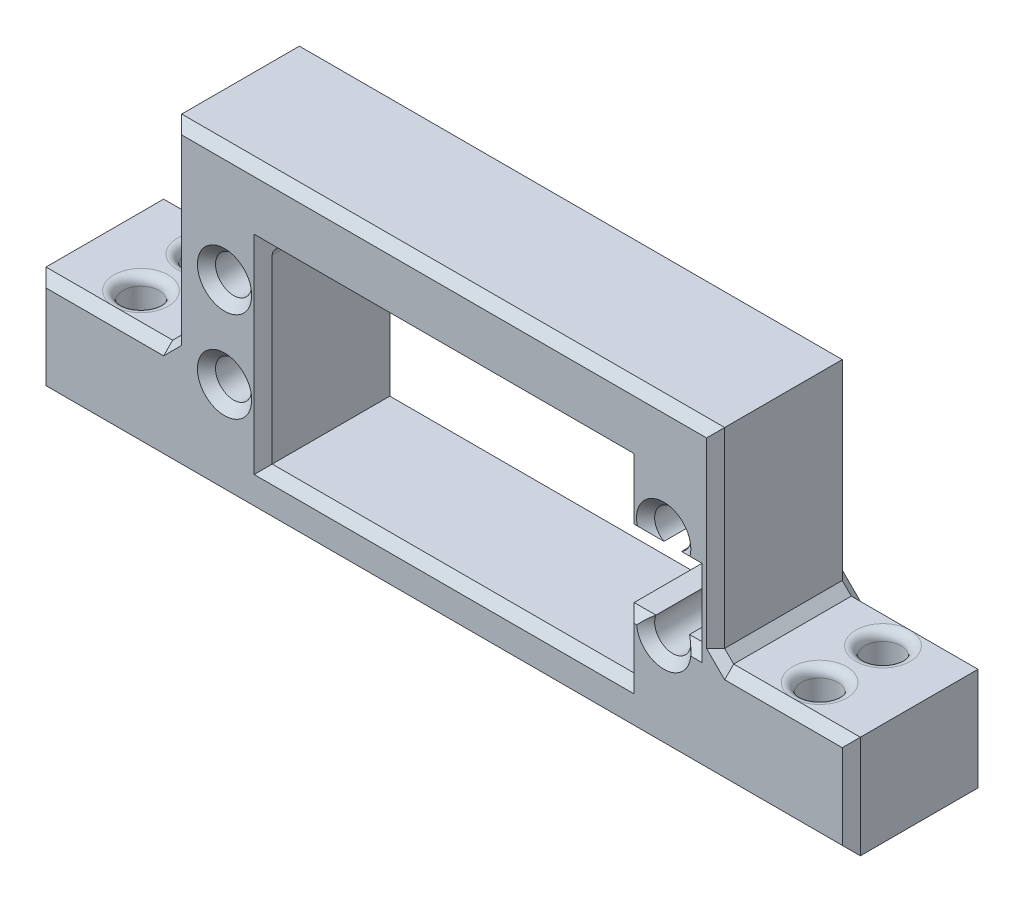
from build123d import *

# Parameters (mm, degrees)
SKETCH1_R               = 2
BOSS_EXTRUDE1_DEPTH     = 15
CUT_EXTRUDE1_DEPTH      = 53.347854185
CUT_EXTRUDE1_DEPTH_BACK = 53.347854185
SKETCH2_R               = 2
CHAMFER1_SIZE           = 1
FILLET1_R               = 1


with BuildPart() as part:
    # Sketch1 → Boss-Extrude1 (new body)
    with BuildSketch(Plane.XY):
        Polygon((30, 6.357329932), (30, 28.5), (-30, 28.5), (-30, 6.357329932), (-45, 6.357329932), (-45, -5), (45, -5), (45, 6.357329932), align=None)
        with BuildLine():
            Line((-20, 0), (-20, 21))
            Line((-20, 21), (20, 21))
            Line((20, 21), (20, 14.25))
            Line((20, 14.25), (23.296754163, 14.25))
            ThreePointArc((23.296754163, 14.25), (24.265, 18), (25.233245837, 14.25))
            Line((25.233245837, 14.25), (27.5, 14.25))
            Line((27.5, 14.25), (27.5, 6.75))
            Line((27.5, 6.75), (26.119049622, 6.75))
            ThreePointArc((26.119049622, 6.75), (24.265, 4), (22.410950378, 6.75))
            Line((22.410950378, 6.75), (20, 6.75))
            Line((20, 6.75), (20, 0))
            Line((20, 0), (-20, 0))
        make_face(mode=Mode.SUBTRACT)
        with Locations((-24.265, 16)):
            Circle(SKETCH1_R, mode=Mode.SUBTRACT)
        with Locations((-24.265, 6)):
            Circle(SKETCH1_R, mode=Mode.SUBTRACT)
    extrude(amount=BOSS_EXTRUDE1_DEPTH)

    # Sketch2 → Cut-Extrude1 (cut, two sides: drawn at the far end of the back side and taken through both)
    with BuildSketch(Plane(origin=(0, 6.357329932, 0), x_dir=(1, 0, 0), z_dir=(0, 1, 0)).offset(-CUT_EXTRUDE1_DEPTH_BACK)):
        with Locations(Location((-37.5, -4, 0), (0, 0, 180))):
            Circle(SKETCH2_R)
        with Locations(Location((-37.5, -11, 0), (0, 0, 180))):
            Circle(SKETCH2_R)
        with Locations(Location((37.5, -11, 0), (0, 0, 180))):
            Circle(SKETCH2_R)
        with Locations(Location((37.5, -4, 0), (0, 0, 180))):
            Circle(SKETCH2_R)
    extrude(amount=CUT_EXTRUDE1_DEPTH + CUT_EXTRUDE1_DEPTH_BACK, mode=Mode.SUBTRACT)

    # Chamfer1
    chamfer1_edges = [part.edges().sort_by_distance(p)[0] for p in [
        (24.265, 4, 15),
        (21.205475189, 6.75, 15),
        (-26.265, 6, 15),
        (-26.265, 16, 15),
        (37.5, 6.357329932, 15),
        (30, 17.428664966, 15),
        (-26.265, 16, 0),
        (-26.265, 6, 0),
        (21.205475189, 6.75, 0),
        (0, 28.5, 15),
        (24.265, 4, 0),
        (26.809524811, 6.75, 0),
        (27.5, 10.5, 0),
        (26.366622918, 14.25, 0),
        (24.265, 18, 0),
        (21.648377082, 14.25, 0),
        (20, 17.625, 0),
        (0, 21, 0),
        (-20, 10.5, 0),
        (0, 0, 0),
        (-30, 17.428664966, 15),
        (20, 3.375, 0),
        (0, -5, 0),
        (-45, 0.678664966, 0),
        (-37.5, 6.357329932, 0),
        (-30, 17.428664966, 0),
        (0, 28.5, 0),
        (30, 17.428664966, 0),
        (37.5, 6.357329932, 0),
        (45, 0.678664966, 0),
        (-37.5, 6.357329932, 15),
        (-45, 0.678664966, 15),
        (-30, 6.357329932, 7.5),
        (30, 6.357329932, 7.5),
        (0, -5, 15),
        (20, 3.375, 15),
        (0, 0, 15),
        (-20, 10.5, 15),
        (0, 21, 15),
        (20, 17.625, 15),
        (45, 0.678664966, 15),
        (21.648377082, 14.25, 15),
        (24.265, 18, 15),
        (26.366622918, 14.25, 15),
        (27.5, 10.5, 15),
        (26.809524811, 6.75, 15),
    ]]
    chamfer(chamfer1_edges, length=CHAMFER1_SIZE)

    # Fillet1
    fillet1_edges = [part.edges().sort_by_distance(p)[0] for p in [
        (39.5, 6.357329932, 4),
        (39.5, 6.357329932, 11),
        (39.5, -5, 11),
        (-35.5, 6.357329932, 11),
        (-35.5, 6.357329932, 4),
        (20, 21, 7.5),
        (-20, 21, 7.5),
    ]]
    fillet(fillet1_edges, radius=FILLET1_R - 0.0001)  # a hair under: the kernel refuses the full size


solid = part.part
